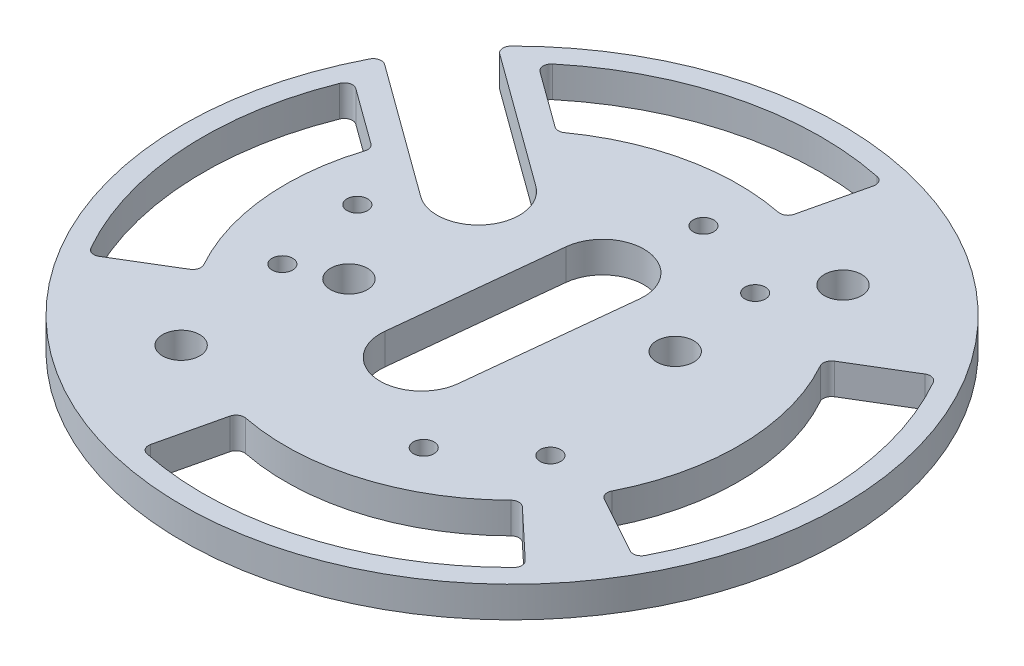
from build123d import *

# Parameters (mm, degrees)
SKETCH1_R           = 101.6
BOSS_EXTRUDE1_DEPTH = 9.525
SKETCH2_R           = 4.7625
SKETCH2_R_2         = 3.175
CUT_EXTRUDE1_DEPTH  = 22.86
SKETCH3_R           = 4.7625
CUT_EXTRUDE2_DEPTH  = 144.999463975
FILLET1_R           = 2.54
FILLET3_R           = 2.54
SKETCH4_R           = 5.715
CUT_EXTRUDE3_DEPTH  = 17.78


with BuildPart() as part:
    # Sketch1 → Boss-Extrude1 (new body)
    with BuildSketch(Plane(origin=(0, 0, 0), x_dir=(1, 0, 0), z_dir=(0, 1, 0))):
        with Locations(Location((0, 0, 0), (0, 0, 90))):
            Circle(SKETCH1_R)
    extrude(amount=BOSS_EXTRUDE1_DEPTH)

    # Sketch2 → Cut-Extrude1 (cut)
    with BuildSketch(Plane(origin=(0, 9.525, 0), x_dir=(1, 0, 0), z_dir=(0, 1, 0))):
        with BuildLine():
            Line((-9.955759688, 26.595729902), (-15.303128109, -23.922045692))
            ThreePointArc((-15.303128109, -23.922045692), (-4.010526316, -37.888331696), (9.955759688, -26.595729902))
            Line((9.955759688, -26.595729902), (15.303128109, 23.922045692))
            ThreePointArc((15.303128109, 23.922045692), (4.010526316, 37.888331696), (-9.955759688, 26.595729902))
        make_face()
        with Locations(Location((34.817520913, 15.470948176, 0), (0, 0, 270))):
            Circle(SKETCH2_R)
        with Locations(Location((-34.817520913, -15.470948176, 0), (0, 0, 270))):
            Circle(SKETCH2_R)
        with BuildLine():
            Line((-30.765292524, 38.093536125), (-87.237043764, 79.186441231))
            Line((-87.237043764, 79.186441231), (-104.485964967, 60.325))
            Line((-104.485964967, 60.325), (-45.710214871, 17.555539727))
            ThreePointArc((-45.710214871, 17.555539727), (-27.968755498, 20.352076753), (-30.765292524, 38.093536125))
        make_face()
        with Locations(Location((5.646300897, 53.341856998, 0), (0, 0, 270))):
            Circle(SKETCH2_R_2)
        with Locations(Location((31.560768513, 43.372252797, 0), (0, 0, 270))):
            Circle(SKETCH2_R_2)
        with Locations(Location((-53.341856998, 5.646300897, 0), (0, 0, 270))):
            Circle(SKETCH2_R_2)
        with Locations(Location((43.372252797, -31.560768513, 0), (0, 0, 270))):
            Circle(SKETCH2_R_2)
        with Locations(Location((-49.018553694, -21.781088485, 0), (0, 0, 270))):
            Circle(SKETCH2_R_2)
        with Locations(Location((21.781088485, -49.018553694, 0), (0, 0, 270))):
            Circle(SKETCH2_R_2)
    extrude(amount=-CUT_EXTRUDE1_DEPTH, mode=Mode.SUBTRACT)

    # Sketch3 → Cut-Extrude2 (cut, through all)
    with BuildSketch(Plane(origin=(0, 9.525, 0), x_dir=(1, 0, 0), z_dir=(0, 1, 0))):
        with BuildLine():
            Line((61.173834056, -33.71623536), (83.418864622, -45.976684582))
            ThreePointArc((83.418864622, -45.976684582), (95.231198209, 1.892455481), (81.526409141, 49.254513627))
            Line((81.526409141, 49.254513627), (59.78603337, 36.119976659))
            ThreePointArc((59.78603337, 36.119976659), (69.83621202, 1.387800686), (61.173834056, -33.71623536))
        make_face()
        with BuildLine():
            ThreePointArc((50.898077232, -47.837310063), (20.160372855, -66.87736438), (-15.979287148, -67.997682918))
            Line((-15.979287148, -67.997682918), (-21.78993702, -92.72411307))
            ThreePointArc((-21.78993702, -92.72411307), (27.491417529, -91.196405972), (69.406468953, -65.232695541))
            Line((69.406468953, -65.232695541), (50.898077232, -47.837310063))
        make_face()
        with BuildLine():
            ThreePointArc((-59.78603337, -36.119976659), (-69.466812234, -7.306469604), (-65.992729528, 22.890656378))
            Line((-65.992729528, 22.890656378), (-87.200441174, 38.322911673))
            ThreePointArc((-87.200441174, 38.322911673), (-95.050717303, -6.15821729), (-81.526409141, -49.254513627))
            Line((-81.526409141, -49.254513627), (-59.78603337, -36.119976659))
        make_face()
        with BuildLine():
            Line((-63.288565419, 71.183705911), (-42.080853774, 55.751450615))
            ThreePointArc((-42.080853774, 55.751450615), (-14.415807175, 68.34622889), (15.979287148, 67.997682918))
            Line((15.979287148, 67.997682918), (21.78993702, 92.72411307))
            ThreePointArc((21.78993702, 92.72411307), (-23.37800943, 92.33651052), (-63.288565419, 71.183705911))
        make_face()
        with Locations(Location((42.966651746, 59.046739645, 0), (0, 0, 270))):
            Circle(SKETCH3_R)
        with Locations(Location((-42.966651746, -59.046739645, 0), (0, 0, 270))):
            Circle(SKETCH3_R)
    extrude(amount=-CUT_EXTRUDE2_DEPTH, mode=Mode.SUBTRACT)

    # Fillet1
    fillet1_edges = [part.edges().sort_by_distance(p)[0] for p in [
        (-74.035185173, 4.7625, -69.579820037),
        (-88.980107519, 4.7625, -49.041823639),
    ]]
    fillet(fillet1_edges, radius=FILLET1_R)

    # Fillet3
    fillet3_edges = [part.edges().sort_by_distance(p)[0] for p in [
        (15.979287148, 4.7625, -67.997682918),
        (-42.080853774, 4.7625, -55.751450615),
        (-63.288565419, 4.7625, -71.183705911),
        (21.78993702, 4.7625, -92.72411307),
        (59.78603337, 4.7625, -36.119976659),
        (81.526409141, 4.7625, -49.254513627),
        (83.418864622, 4.7625, 45.976684582),
        (61.173834056, 4.7625, 33.71623536),
        (-15.979287148, 4.7625, 67.997682918),
        (50.898077232, 4.7625, 47.837310063),
        (69.406468953, 4.7625, 65.232695541),
        (-21.78993702, 4.7625, 92.72411307),
        (-59.78603337, 4.7625, 36.119976659),
        (-81.526409141, 4.7625, 49.254513627),
        (-87.200441174, 4.7625, -38.322911673),
        (-65.992729528, 4.7625, -22.890656378),
    ]]
    fillet(fillet3_edges, radius=FILLET3_R)

    # Sketch4 → Cut-Extrude3 (cut)
    with BuildSketch(Plane(origin=(0, 9.525, 0), x_dir=(1, 0, 0), z_dir=(0, 1, 0))):
        with Locations(Location((42.966651746, 59.046739645, 0), (0, 0, 270))):
            Circle(SKETCH4_R)
        with Locations(Location((-42.966651746, -59.046739645, 0), (0, 0, 270))):
            Circle(SKETCH4_R)
        with Locations(Location((-34.817520913, -15.470948176, 0), (0, 0, 270))):
            Circle(SKETCH4_R)
        with Locations(Location((34.817520913, 15.470948176, 0), (0, 0, 270))):
            Circle(SKETCH4_R)
    extrude(amount=-CUT_EXTRUDE3_DEPTH, mode=Mode.SUBTRACT)


solid = part.part
